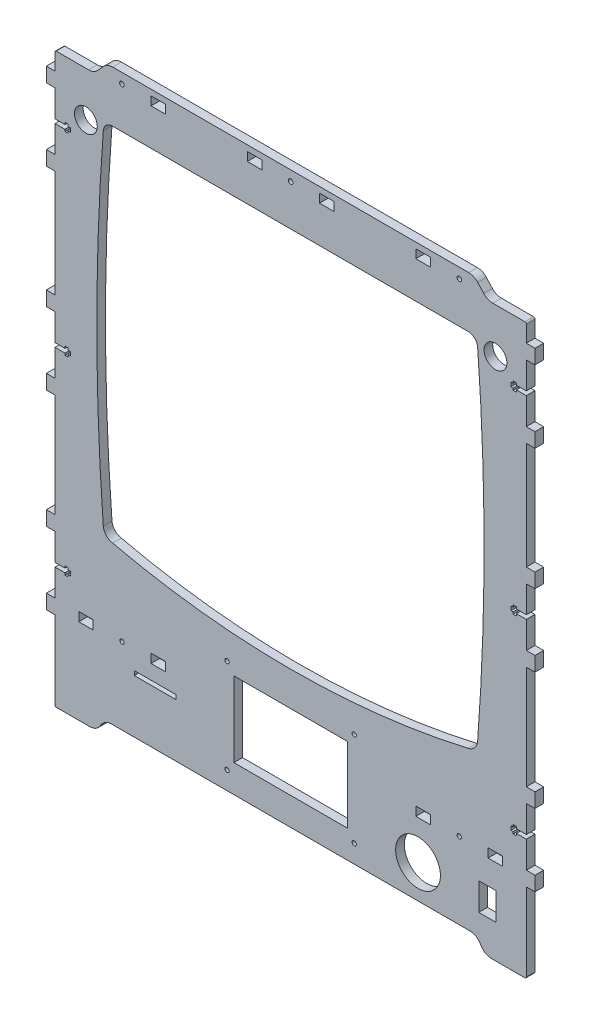
from build123d import *

# Parameters (mm, degrees)
SKETCH_1_R      = 1.5
SKETCH_1_R_2    = 15.5
SKETCH_1_R_3    = 1.6
SKETCH_1_R_4    = 7.9
SKETCH_1_W      = 10
SKETCH_1_H      = 6
SKETCH_1_H_2    = 6.19978722
SKETCH_1_H_3    = 6.200648329
SKETCH_1_H_4    = 6.199787243
SKETCH_1_W_2    = 78.6
SKETCH_1_H_5    = 51.99959895
SKETCH_1_W_3    = 12
SKETCH_1_H_6    = 19
SKETCH_1_W_4    = 29
SKETCH_1_H_7    = 3
EXTRUDE_2_DEPTH = 6


with BuildPart() as part:
    # Эскиз1 → Бобышка-Вытянуть2 (new body)
    with BuildSketch(Plane.XY):
        with BuildLine():
            Line((-162.349245127, -146.930877786), (-168.354558228, -146.930877786))
            Line((-168.354558228, -146.930877786), (-168.354558228, -136.930877786))
            Line((-168.354558228, -136.930877786), (-162.354558228, -136.930877786))
            Line((-162.354558228, -136.930877786), (-162.354558228, -118.320877786))
            Line((-162.354558228, -118.320877786), (-155.442615928, -118.320877786))
            Line((-155.442615928, -118.320877786), (-155.442615928, -119.72098181))
            Line((-155.442615928, -119.72098181), (-153.241793345, -119.72098181))
            Line((-153.241793345, -119.72098181), (-153.241793345, -118.321100605))
            Line((-153.241793345, -118.321100605), (-151.743644127, -118.321100605))
            Line((-151.743644127, -118.321100605), (-151.743644127, -115.521795283))
            Line((-151.743644127, -115.521795283), (-153.245115684, -115.521795283))
            Line((-153.245115684, -115.521795283), (-153.245115684, -114.120877786))
            Line((-153.245115684, -114.120877786), (-155.445116095, -114.120877786))
            Line((-155.445116095, -114.120877786), (-155.445116095, -115.520877786))
            Line((-155.445116095, -115.520877786), (-162.354558228, -115.520877786))
            Line((-162.354558228, -115.520877786), (-162.354558228, -96.940877786))
            Line((-162.354558228, -96.940877786), (-168.354558228, -96.940877786))
            Line((-168.354558228, -96.940877786), (-168.354558228, -86.940877786))
            Line((-168.354558228, -86.940877786), (-162.354558228, -86.940877786))
            Line((-162.354558228, -86.940877786), (-162.354558228, -15.210877786))
            Line((-162.354558228, -15.210877786), (-168.354558228, -15.210877786))
            Line((-168.354558228, -15.210877786), (-168.354558228, -5.210877786))
            Line((-168.354558228, -5.210877786), (-162.354558228, -5.210877786))
            Line((-162.354558228, -5.210877786), (-162.354558228, 13.389122214))
            Line((-162.354558228, 13.389122214), (-155.444055652, 13.389122214))
            Line((-155.444055652, 13.389122214), (-155.444055652, 11.989017706))
            Line((-155.444055652, 11.989017706), (-153.243233069, 11.989017706))
            Line((-153.243233069, 11.989017706), (-153.243233069, 13.362239479))
            Line((-153.243233069, 13.362239479), (-151.742761748, 13.362239479))
            Line((-151.742761748, 13.362239479), (-151.742761748, 16.188530845))
            Line((-151.742761748, 16.188530845), (-153.245115684, 16.188530845))
            Line((-153.245115684, 16.188530845), (-153.245115684, 17.589122214))
            Line((-153.245115684, 17.589122214), (-155.445116095, 17.589122214))
            Line((-155.445116095, 17.589122214), (-155.445116095, 16.189122214))
            Line((-155.445116095, 16.189122214), (-162.354558228, 16.189122214))
            Line((-162.354558228, 16.189122214), (-162.354558228, 34.789122214))
            Line((-162.354558228, 34.789122214), (-168.354558228, 34.789122214))
            Line((-168.354558228, 34.789122214), (-168.354558228, 44.789122214))
            Line((-168.354558228, 44.789122214), (-162.354558228, 44.789122214))
            Line((-162.354558228, 44.789122214), (-162.354558228, 118.949122214))
            Line((-162.354558228, 118.949122214), (-168.354558228, 118.949122214))
            Line((-168.354558228, 118.949122214), (-168.354558228, 128.949122214))
            Line((-168.354558228, 128.949122214), (-162.354558228, 128.949122214))
            Line((-162.354558228, 128.949122214), (-162.354558228, 147.549122214))
            Line((-162.354558228, 147.549122214), (-155.444087484, 147.549122214))
            Line((-155.444087484, 147.549122214), (-155.444087484, 146.149017702))
            Line((-155.444087484, 146.149017702), (-153.243264902, 146.149017702))
            Line((-153.243264902, 146.149017702), (-153.243264902, 147.548898907))
            Line((-153.243264902, 147.548898907), (-151.737469071, 147.548898907))
            Line((-151.737469071, 147.548898907), (-151.737951164, 150.348204717))
            Line((-151.737951164, 150.348204717), (-153.239802583, 150.348204717))
            Line((-153.239802583, 150.348204717), (-153.239802583, 151.749122214))
            Line((-153.239802583, 151.749122214), (-155.439802995, 151.749122214))
            Line((-155.439802995, 151.749122214), (-155.439802995, 150.349122214))
            Line((-155.439802995, 150.349122214), (-162.349245127, 150.349122214))
            Line((-162.349245127, 150.349122214), (-162.349245127, 168.949122214))
            Line((-162.349245127, 168.949122214), (-168.349245127, 168.949122214))
            Line((-168.349245127, 168.949122214), (-168.349245127, 178.949122214))
            Line((-168.349245127, 178.949122214), (-162.349245127, 178.949122214))
            Line((-162.349245127, 178.949122214), (-162.349245127, 190.349122214))
            ThreePointArc((-162.349245127, 190.349122214), (-162.144381362, 191.019766001), (-161.525304034, 191.349122214))
            Line((-161.525304034, 191.349122214), (-139.092392644, 191.349122214))
            ThreePointArc((-139.092392644, 191.349122214), (-135.666701236, 192.070006687), (-132.82207518, 194.110383773))
            Line((-132.82207518, 194.110383773), (-128.724185584, 198.587860655))
            ThreePointArc((-128.724185584, 198.587860655), (-125.879559527, 200.62823774), (-122.453868119, 201.349122214))
            Line((-122.453868119, 201.349122214), (123.955377865, 201.349122214))
            ThreePointArc((123.955377865, 201.349122214), (127.381069274, 200.62823774), (130.22569533, 198.587860655))
            Line((130.22569533, 198.587860655), (134.323584926, 194.110383773))
            ThreePointArc((134.323584926, 194.110383773), (137.168210982, 192.070006687), (140.59390239, 191.349122214))
            Line((140.59390239, 191.349122214), (162.850754873, 191.349122214))
            ThreePointArc((162.850754873, 191.349122214), (163.557861654, 191.056228995), (163.850754873, 190.349122214))
            Line((163.850754873, 190.349122214), (163.850754873, 178.949122214))
            Line((163.850754873, 178.949122214), (169.850754873, 178.949122214))
            Line((169.850754873, 178.949122214), (169.850754873, 168.949122214))
            Line((169.850754873, 168.949122214), (163.850754873, 168.949122214))
            Line((163.850754873, 168.949122214), (163.850754873, 150.349122214))
            Line((163.850754873, 150.349122214), (156.938753666, 150.349122214))
            Line((156.938753666, 150.349122214), (156.938753666, 151.74917383))
            Line((156.938753666, 151.74917383), (154.741012446, 151.74917383))
            Line((154.741012446, 151.74917383), (154.741012446, 150.349292624))
            Line((154.741012446, 150.349292624), (153.241012446, 150.349292624))
            Line((153.241012446, 150.349292624), (153.241012446, 147.550209336))
            Line((153.241012446, 147.550209336), (154.741012446, 147.550209336))
            Line((154.741012446, 147.550209336), (154.741012446, 146.149291839))
            Line((154.741012446, 146.149291839), (156.941736218, 146.149291839))
            Line((156.941736218, 146.149291839), (156.941736218, 147.549122214))
            Line((156.941736218, 147.549122214), (163.851237257, 147.549122214))
            Line((163.851237257, 147.549122214), (163.851237257, 128.949122214))
            Line((163.851237257, 128.949122214), (169.851237081, 128.949122214))
            Line((169.851237081, 128.949122214), (169.851237081, 118.949122214))
            Line((169.851237081, 118.949122214), (163.851237081, 118.949122214))
            Line((163.851237081, 118.949122214), (163.851237081, 44.789122214))
            Line((163.851237081, 44.789122214), (169.851237081, 44.789122214))
            Line((169.851237081, 44.789122214), (169.851237081, 34.789122214))
            Line((169.851237081, 34.789122214), (163.851237081, 34.789122214))
            Line((163.851237081, 34.789122214), (163.851237081, 16.189122214))
            Line((163.851237081, 16.189122214), (156.939202586, 16.189122214))
            Line((156.939202586, 16.189122214), (156.939202586, 17.562103605))
            Line((156.939202586, 17.562103605), (154.739101533, 17.562103605))
            Line((154.739101533, 17.562103605), (154.739101533, 16.189291862))
            Line((154.739101533, 16.189291862), (153.239956889, 16.189291862))
            Line((153.239956889, 16.189291862), (153.239956889, 13.39020884))
            Line((153.239956889, 13.39020884), (154.741461365, 13.39020884))
            Line((154.741461365, 13.39020884), (154.741461365, 11.989291851))
            Line((154.741461365, 11.989291851), (156.941702753, 11.989291851))
            Line((156.941702753, 11.989291851), (156.941702753, 13.389122214))
            Line((156.941702753, 13.389122214), (163.851237081, 13.389122214))
            Line((163.851237081, 13.389122214), (163.851237081, -5.210877786))
            Line((163.851237081, -5.210877786), (169.851237081, -5.210877786))
            Line((169.851237081, -5.210877786), (169.851237081, -15.210877786))
            Line((169.851237081, -15.210877786), (163.851237081, -15.210877786))
            Line((163.851237081, -15.210877786), (163.851237081, -86.940877786))
            Line((163.851237081, -86.940877786), (169.851237081, -86.940877786))
            Line((169.851237081, -86.940877786), (169.851237081, -96.940877786))
            Line((169.851237081, -96.940877786), (163.939237081, -96.940877786))
            Line((163.939237081, -96.940877786), (163.939237081, -115.520877786))
            Line((163.939237081, -115.520877786), (156.93923577, -115.520877786))
            Line((156.93923577, -115.520877786), (156.93923577, -114.122358317))
            Line((156.93923577, -114.122358317), (154.738205666, -114.122358317))
            Line((154.738205666, -114.122358317), (154.738205666, -115.522239523))
            Line((154.738205666, -115.522239523), (153.238413576, -115.522239523))
            Line((153.238413576, -115.522239523), (153.238413576, -118.322187164))
            Line((153.238413576, -118.322187164), (154.740539372, -118.322187164))
            Line((154.740539372, -118.322187164), (154.740539372, -119.723103854))
            Line((154.740539372, -119.723103854), (156.939923762, -119.723103854))
            Line((156.939923762, -119.723103854), (156.939923762, -118.320877786))
            Line((156.939923762, -118.320877786), (163.851344603, -118.320877786))
            Line((163.851344603, -118.320877786), (163.851344603, -136.930877786))
            Line((163.851344603, -136.930877786), (169.845441772, -136.930877786))
            Line((169.845441772, -136.930877786), (169.845441772, -146.930877786))
            Line((169.845441772, -146.930877786), (163.845441772, -146.930877786))
            Line((163.845441772, -146.930877786), (163.845441772, -200.973061911))
            ThreePointArc((163.845441772, -200.973061911), (163.501928515, -201.680136073), (162.762754873, -201.947675896))
            Line((162.762754873, -201.947675896), (139.726369967, -201.947675896))
            ThreePointArc((139.726369967, -201.947675896), (136.178541077, -201.14298723), (133.302992201, -198.914572468))
            Line((133.302992201, -198.914572468), (131.246288055, -195.894919373))
            ThreePointArc((131.246288055, -195.894919373), (128.327165513, -193.654997866), (124.734910288, -192.858614055))
            Line((124.734910288, -192.858614055), (-123.233400542, -192.858614055))
            ThreePointArc((-123.233400542, -192.858614055), (-126.825655767, -193.654997866), (-129.744778309, -195.894919373))
            Line((-129.744778309, -195.894919373), (-131.801482455, -198.914572469))
            ThreePointArc((-131.801482455, -198.914572469), (-134.720604996, -201.154493976), (-138.312860221, -201.950877786))
            Line((-138.312860221, -201.950877786), (-161.437304034, -201.950877786))
            ThreePointArc((-161.437304034, -201.950877786), (-162.093143033, -201.646865801), (-162.349245127, -200.970877786))
            Line((-162.349245127, -200.970877786), (-162.349245127, -146.930877786))
        make_face()
        with Locations((44.745441772, -115.136083352)):
            Circle(SKETCH_1_R, mode=Mode.SUBTRACT)
        with Locations((44.745441772, -180.385682302)):
            Circle(SKETCH_1_R, mode=Mode.SUBTRACT)
        with Locations((-43.254558228, -180.385682302)):
            Circle(SKETCH_1_R, mode=Mode.SUBTRACT)
        with Locations((-43.254558228, -115.136083352)):
            Circle(SKETCH_1_R, mode=Mode.SUBTRACT)
        with Locations((88.894233967, -169.827856004)):
            Circle(SKETCH_1_R_2, mode=Mode.SUBTRACT)
        with Locations((0.750754873, 194.349122214)):
            Circle(SKETCH_1_R_3, mode=Mode.SUBTRACT)
        with Locations((-116.049245127, 194.349122214)):
            Circle(SKETCH_1_R_3, mode=Mode.SUBTRACT)
        with Locations((117.550754873, 194.349122214)):
            Circle(SKETCH_1_R_3, mode=Mode.SUBTRACT)
        with Locations((-140.999245127, 160.349122214)):
            Circle(SKETCH_1_R_4, mode=Mode.SUBTRACT)
        with Locations((142.500754873, 160.349122214)):
            Circle(SKETCH_1_R_4, mode=Mode.SUBTRACT)
        with Locations((-115.994558228, -139.818855889)):
            Circle(SKETCH_1_R, mode=Mode.SUBTRACT)
        with Locations((117.485441772, -139.808103745)):
            Circle(SKETCH_1_R, mode=Mode.SUBTRACT)
        with Locations((-90.889245127, 194.349122214)):
            Rectangle(SKETCH_1_W, SKETCH_1_H, mode=Mode.SUBTRACT)
        with Locations((92.390754873, 194.349122214)):
            Rectangle(SKETCH_1_W, SKETCH_1_H, mode=Mode.SUBTRACT)
        with Locations((92.365441772, -139.787600853)):
            Rectangle(SKETCH_1_W, SKETCH_1_H_2, mode=Mode.SUBTRACT)
        with Locations((142.385441772, -139.788031408)):
            Rectangle(SKETCH_1_W, SKETCH_1_H_3, mode=Mode.SUBTRACT)
        with Locations((-140.894558228, -139.78719961)):
            Rectangle(SKETCH_1_W, SKETCH_1_H_2, mode=Mode.SUBTRACT)
        with Locations((-90.874558228, -139.787199622)):
            Rectangle(SKETCH_1_W, SKETCH_1_H_4, mode=Mode.SUBTRACT)
        with Locations((-24.239245127, 194.349122214)):
            Rectangle(SKETCH_1_W, SKETCH_1_H, mode=Mode.SUBTRACT)
        with Locations((25.740754873, 194.349122214)):
            Rectangle(SKETCH_1_W, SKETCH_1_H, mode=Mode.SUBTRACT)
        with BuildLine():
            Line((-122.399111136, 165.873018888), (123.624117201, 165.873018888))
            ThreePointArc((123.624117201, 165.873018888), (128.051771635, 164.15368067), (130.158760923, 159.896822223))
            ThreePointArc((130.158760923, 159.896822223), (134.629570514, 41.460685741), (130.125352868, -76.974184913))
            ThreePointArc((130.125352868, -76.974184913), (127.977308293, -81.497473491), (123.648924914, -84.015276578))
            ThreePointArc((123.648924914, -84.015276578), (0.588905308, -98.015276578), (-122.471114299, -84.015276578))
            ThreePointArc((-122.471114299, -84.015276578), (-126.930378694, -81.617835611), (-128.947210492, -76.974006197))
            ThreePointArc((-128.947210492, -76.974006197), (-133.43700353, 41.461656712), (-128.934108856, 159.896822224))
            ThreePointArc((-128.934108856, 159.896822224), (-126.846261851, 164.174875124), (-122.399111136, 165.873018888))
        make_face(mode=Mode.SUBTRACT)
        with Locations((0.745441772, -147.635882827)):
            Rectangle(SKETCH_1_W_2, SKETCH_1_H_5, mode=Mode.SUBTRACT)
        with Locations((136.938754873, -169.176180946)):
            Rectangle(SKETCH_1_W_3, SKETCH_1_H_6, mode=Mode.SUBTRACT)
        with Locations((-93.004246156, -154.427084063)):
            Rectangle(SKETCH_1_W_4, SKETCH_1_H_7, mode=Mode.SUBTRACT)
    extrude(amount=EXTRUDE_2_DEPTH)


solid = part.part
